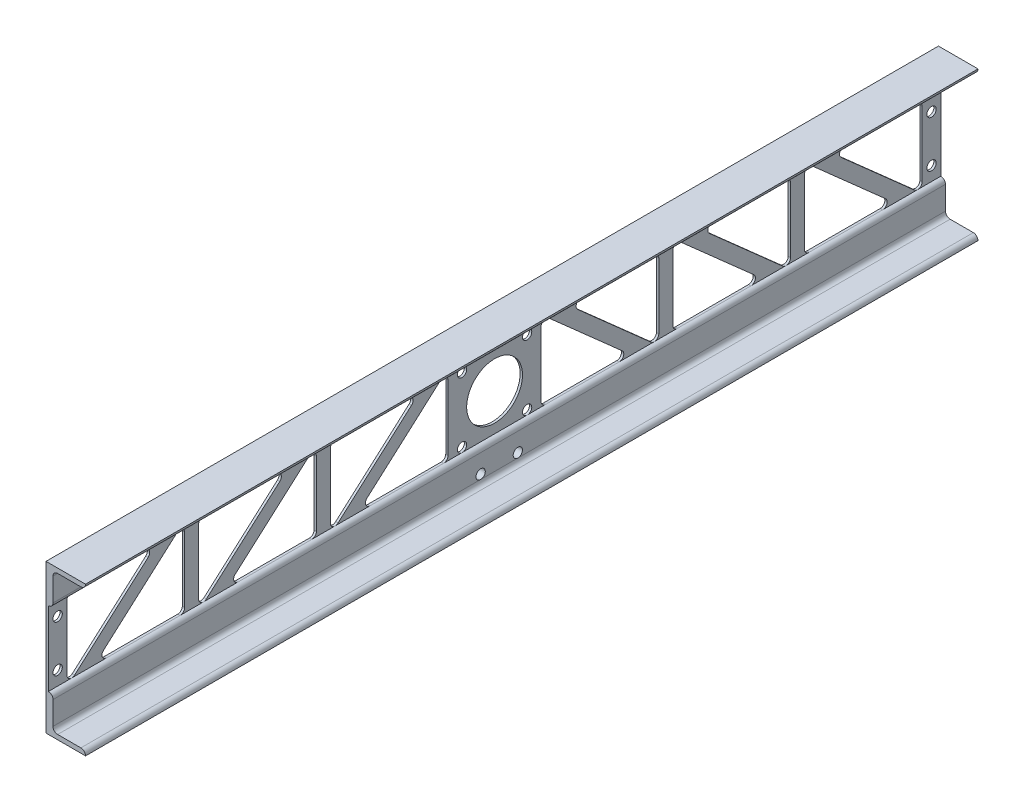
from build123d import *

# Parameters (mm, degrees)
SKETCH1_W           = 1.6002
SKETCH1_H           = 101.6
BOSS_EXTRUDE1_DEPTH = 304.8
BOSS_EXTRUDE2_DEPTH = 304.8
SKETCH3_R           = 19.05
CUT_EXTRUDE1_DEPTH  = 323.289869527
SKETCH4_R           = 3.175
CUT_EXTRUDE2_DEPTH  = 323.289869527
SKETCH5_R           = 3.175
CUT_EXTRUDE3_DEPTH  = 323.289869527
SKETCH6_R           = 3.175
CUT_EXTRUDE4_DEPTH  = 323.055198103
SKETCH7_R           = 3.175
CUT_EXTRUDE5_DEPTH  = 323.055198103
SKETCH8_R           = 3.175
CUT_EXTRUDE6_DEPTH  = 323.055198103


with BuildPart() as part:
    # Sketch1 → Boss-Extrude1 (new, symmetric)
    with BuildSketch(Plane.XY):
        with Locations((0.8001, 50.8)):
            Rectangle(SKETCH1_W, SKETCH1_H)
    extrude(amount=BOSS_EXTRUDE1_DEPTH, both=True)

    # Sketch2 → Boss-Extrude2 (add, symmetric)
    with BuildSketch(Plane.XY):
        with BuildLine():
            Line((27.0002, 101.6), (1.6002, 101.6))
            Line((1.6002, 101.6), (1.6002, 76.2))
            ThreePointArc((1.6002, 76.2), (3.84526403, 77.12993597), (4.7752, 79.375))
            Line((4.7752, 79.375), (4.7752, 95.25))
            ThreePointArc((4.7752, 95.25), (5.70513597, 97.49506403), (7.9502, 98.425))
            Line((7.9502, 98.425), (23.8252, 98.425))
            ThreePointArc((23.8252, 98.425), (26.07026403, 99.35493597), (27.0002, 101.6))
        make_face()
        with BuildLine():
            Line((7.9502, 3.175), (23.8252, 3.175))
            ThreePointArc((23.8252, 3.175), (26.07026403, 2.24506403), (27.0002, 0))
            Line((27.0002, 0), (1.6002, 0))
            Line((1.6002, 0), (1.6002, 25.4))
            ThreePointArc((1.6002, 25.4), (3.84526403, 24.47006403), (4.7752, 22.225))
            Line((4.7752, 22.225), (4.7752, 6.35))
            ThreePointArc((4.7752, 6.35), (5.70513597, 4.10493597), (7.9502, 3.175))
        make_face()
    extrude(amount=BOSS_EXTRUDE2_DEPTH, both=True)

    # Sketch3 → Cut-Extrude1 (cut, through all)
    with BuildSketch(Plane(origin=(1.6002, 0, 0), x_dir=(0, 0, -1), z_dir=(1, 0, 0))):
        with Locations((0, 50.8)):
            Circle(SKETCH3_R)
        with BuildLine():
            Line((-292.1, 73.025), (-292.1, 28.575))
            ThreePointArc((-292.1, 28.575), (-290.227720313, 25.679564837), (-286.819026907, 26.198973416))
            Line((-286.819026907, 26.198973416), (-236.669107137, 70.648973416))
            ThreePointArc((-236.669107137, 70.648973416), (-235.806536024, 74.151219471), (-238.77508023, 76.2))
            Line((-238.77508023, 76.2), (-288.925, 76.2))
            ThreePointArc((-288.925, 76.2), (-291.17006403, 75.27006403), (-292.1, 73.025))
        make_face()
        with BuildLine():
            Line((-264.991586436, 25.4), (-214.841666667, 25.4))
            ThreePointArc((-214.841666667, 25.4), (-212.596602636, 26.32993597), (-211.666666667, 28.575))
            Line((-211.666666667, 28.575), (-211.666666667, 73.025))
            ThreePointArc((-211.666666667, 73.025), (-213.538946354, 75.920435163), (-216.94763976, 75.401026584))
            Line((-216.94763976, 75.401026584), (-267.09755953, 30.951026584))
            ThreePointArc((-267.09755953, 30.951026584), (-267.960130642, 27.448780529), (-264.991586436, 25.4))
        make_face()
        with BuildLine():
            Line((-202.141666667, 73.025), (-202.141666667, 28.575))
            ThreePointArc((-202.141666667, 28.575), (-200.26938698, 25.679564837), (-196.860693573, 26.198973416))
            Line((-196.860693573, 26.198973416), (-146.710773804, 70.648973416))
            ThreePointArc((-146.710773804, 70.648973416), (-145.848202691, 74.151219471), (-148.816746897, 76.2))
            Line((-148.816746897, 76.2), (-198.966666667, 76.2))
            ThreePointArc((-198.966666667, 76.2), (-201.211730697, 75.27006403), (-202.141666667, 73.025))
        make_face()
        with BuildLine():
            Line((-126.989306427, 75.401026584), (-177.139226196, 30.951026584))
            ThreePointArc((-177.139226196, 30.951026584), (-178.001797309, 27.448780529), (-175.033253103, 25.4))
            Line((-175.033253103, 25.4), (-124.883333333, 25.4))
            ThreePointArc((-124.883333333, 25.4), (-122.638269303, 26.32993597), (-121.708333333, 28.575))
            Line((-121.708333333, 28.575), (-121.708333333, 73.025))
            ThreePointArc((-121.708333333, 73.025), (-123.58061302, 75.920435163), (-126.989306427, 75.401026584))
        make_face()
        with BuildLine():
            Line((-112.183333333, 73.025), (-112.183333333, 28.575))
            ThreePointArc((-112.183333333, 28.575), (-110.311053646, 25.679564837), (-106.90236024, 26.198973416))
            Line((-106.90236024, 26.198973416), (-56.75244047, 70.648973416))
            ThreePointArc((-56.75244047, 70.648973416), (-55.889869358, 74.151219471), (-58.858413564, 76.2))
            Line((-58.858413564, 76.2), (-109.008333333, 76.2))
            ThreePointArc((-109.008333333, 76.2), (-111.253397364, 75.27006403), (-112.183333333, 73.025))
        make_face()
        with BuildLine():
            Line((-37.030973093, 75.401026584), (-87.180892863, 30.951026584))
            ThreePointArc((-87.180892863, 30.951026584), (-88.043463976, 27.448780529), (-85.07491977, 25.4))
            Line((-85.07491977, 25.4), (-34.925, 25.4))
            ThreePointArc((-34.925, 25.4), (-32.67993597, 26.32993597), (-31.75, 28.575))
            Line((-31.75, 28.575), (-31.75, 73.025))
            ThreePointArc((-31.75, 73.025), (-33.622279687, 75.920435163), (-37.030973093, 75.401026584))
        make_face()
        with BuildLine():
            Line((85.07491977, 25.4), (34.925, 25.4))
            ThreePointArc((34.925, 25.4), (32.67993597, 26.32993597), (31.75, 28.575))
            Line((31.75, 28.575), (31.75, 73.025))
            ThreePointArc((31.75, 73.025), (33.622279687, 75.920435163), (37.030973093, 75.401026584))
            Line((37.030973093, 75.401026584), (87.180892863, 30.951026584))
            ThreePointArc((87.180892863, 30.951026584), (88.043463976, 27.448780529), (85.07491977, 25.4))
        make_face()
        with BuildLine():
            Line((56.75244047, 70.648973416), (106.90236024, 26.198973416))
            ThreePointArc((106.90236024, 26.198973416), (110.311053646, 25.679564837), (112.183333333, 28.575))
            Line((112.183333333, 28.575), (112.183333333, 73.025))
            ThreePointArc((112.183333333, 73.025), (111.253397364, 75.27006403), (109.008333333, 76.2))
            Line((109.008333333, 76.2), (58.858413564, 76.2))
            ThreePointArc((58.858413564, 76.2), (55.889869358, 74.151219471), (56.75244047, 70.648973416))
        make_face()
        with BuildLine():
            Line((175.033253103, 25.4), (124.883333333, 25.4))
            ThreePointArc((124.883333333, 25.4), (122.638269303, 26.32993597), (121.708333333, 28.575))
            Line((121.708333333, 28.575), (121.708333333, 73.025))
            ThreePointArc((121.708333333, 73.025), (123.58061302, 75.920435163), (126.989306427, 75.401026584))
            Line((126.989306427, 75.401026584), (177.139226196, 30.951026584))
            ThreePointArc((177.139226196, 30.951026584), (178.001797309, 27.448780529), (175.033253103, 25.4))
        make_face()
        with BuildLine():
            Line((146.710773804, 70.648973416), (196.860693573, 26.198973416))
            ThreePointArc((196.860693573, 26.198973416), (200.26938698, 25.679564837), (202.141666667, 28.575))
            Line((202.141666667, 28.575), (202.141666667, 73.025))
            ThreePointArc((202.141666667, 73.025), (201.211730697, 75.27006403), (198.966666667, 76.2))
            Line((198.966666667, 76.2), (148.816746897, 76.2))
            ThreePointArc((148.816746897, 76.2), (145.848202691, 74.151219471), (146.710773804, 70.648973416))
        make_face()
        with BuildLine():
            Line((216.94763976, 75.401026584), (267.09755953, 30.951026584))
            ThreePointArc((267.09755953, 30.951026584), (267.960130642, 27.448780529), (264.991586436, 25.4))
            Line((264.991586436, 25.4), (214.841666667, 25.4))
            ThreePointArc((214.841666667, 25.4), (212.596602636, 26.32993597), (211.666666667, 28.575))
            Line((211.666666667, 28.575), (211.666666667, 73.025))
            ThreePointArc((211.666666667, 73.025), (213.538946354, 75.920435163), (216.94763976, 75.401026584))
        make_face()
        with BuildLine():
            Line((236.669107137, 70.648973416), (286.819026907, 26.198973416))
            ThreePointArc((286.819026907, 26.198973416), (290.227720313, 25.679564837), (292.1, 28.575))
            Line((292.1, 28.575), (292.1, 73.025))
            ThreePointArc((292.1, 73.025), (291.17006403, 75.27006403), (288.925, 76.2))
            Line((288.925, 76.2), (238.77508023, 76.2))
            ThreePointArc((238.77508023, 76.2), (235.806536024, 74.151219471), (236.669107137, 70.648973416))
        make_face()
    extrude(amount=-CUT_EXTRUDE1_DEPTH, mode=Mode.SUBTRACT)

    # Sketch4 → Cut-Extrude2 (cut, through all)
    with BuildSketch(Plane(origin=(1.6002, 0, 0), x_dir=(0, 0, -1), z_dir=(1, 0, 0))):
        with Locations((-22.225, 73.025)):
            Circle(SKETCH4_R)
        with Locations((22.225, 73.025)):
            Circle(SKETCH4_R)
        with Locations((22.225, 28.575)):
            Circle(SKETCH4_R)
        with Locations((-22.225, 28.575)):
            Circle(SKETCH4_R)
    extrude(amount=-CUT_EXTRUDE2_DEPTH, mode=Mode.SUBTRACT)

    # Sketch5 → Cut-Extrude3 (cut, through all)
    with BuildSketch(Plane(origin=(1.6002, 0, 0), x_dir=(0, 0, -1), z_dir=(1, 0, 0))):
        with Locations((-298.45, 66.675)):
            Circle(SKETCH5_R)
        with Locations((-298.45, 34.925)):
            Circle(SKETCH5_R)
        with Locations((298.45, 34.925)):
            Circle(SKETCH5_R)
        with Locations((298.45, 66.675)):
            Circle(SKETCH5_R)
    extrude(amount=-CUT_EXTRUDE3_DEPTH, mode=Mode.SUBTRACT)

    # Sketch6 → Cut-Extrude4 (cut, through all)
    with BuildSketch(Plane(origin=(4.7752, 0, 0), x_dir=(0, 0, -1), z_dir=(1, 0, 0))):
        with Locations((139.7, 92.075)):
            Circle(SKETCH6_R)
        with Locations((114.3, 92.075)):
            Circle(SKETCH6_R)
    extrude(amount=-CUT_EXTRUDE4_DEPTH, mode=Mode.SUBTRACT)

    # Sketch7 → Cut-Extrude5 (cut, through all)
    with BuildSketch(Plane(origin=(4.7752, 0, 0), x_dir=(0, 0, -1), z_dir=(1, 0, 0))):
        with Locations((-165.1, 92.075)):
            Circle(SKETCH7_R)
        with Locations((-190.5, 92.075)):
            Circle(SKETCH7_R)
    extrude(amount=-CUT_EXTRUDE5_DEPTH, mode=Mode.SUBTRACT)

    # Sketch8 → Cut-Extrude6 (cut, through all)
    with BuildSketch(Plane(origin=(4.7752, 0, 0), x_dir=(0, 0, -1), z_dir=(1, 0, 0))):
        with Locations((-12.7, 9.525)):
            Circle(SKETCH8_R)
        with Locations((12.7, 9.525)):
            Circle(SKETCH8_R)
    extrude(amount=-CUT_EXTRUDE6_DEPTH, mode=Mode.SUBTRACT)


solid = part.part
